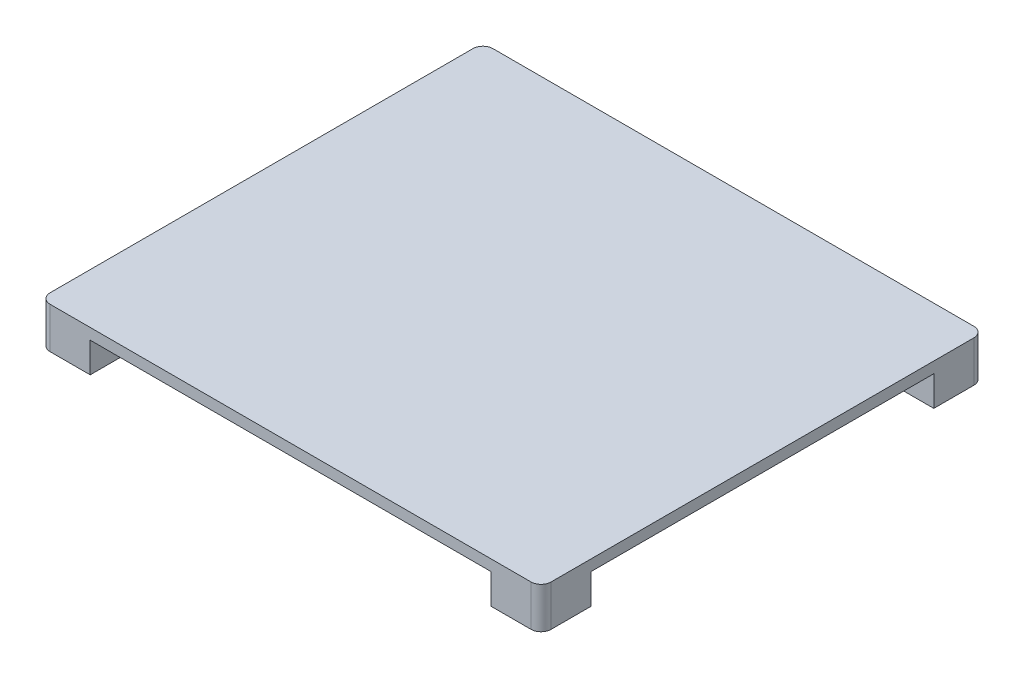
from build123d import *

# Parameters (mm, degrees)
CROQUIS1_W              = 250
CROQUIS1_H              = 221
SALIENTE_EXTRUIR1_DEPTH = 5.5
SALIENTE_EXTRUIR2_DEPTH = 15
CROQUIS3_W              = 150
CROQUIS3_H              = 100
SALIENTE_EXTRUIR3_DEPTH = 15
FILLET1_R               = 5


with BuildPart() as part:
    # Croquis1 → Saliente-Extruir1 (new body)
    with BuildSketch(Plane(origin=(0, 0, 0), x_dir=(1, 0, 0), z_dir=(0, 1, 0))):
        Rectangle(CROQUIS1_W, CROQUIS1_H)
    extrude(amount=SALIENTE_EXTRUIR1_DEPTH)

    # Croquis2 → Saliente-Extruir2 (add)
    with BuildSketch(Plane.XZ):
        Polygon((-125, 110.5), (-100, 110.5), (-100, 90.5), (-105, 90.5), (-105, 85.5), (-125, 85.5), align=None)
        Polygon((125, -110.5), (125, -85.5), (105, -85.5), (105, -90.5), (100, -90.5), (100, -110.5), align=None)
    saliente_extruir2 = extrude(amount=SALIENTE_EXTRUIR2_DEPTH)

    # Simetría1: Saliente-Extruir2 across plane
    add(saliente_extruir2.mirror(Plane.XY))

    # Croquis3 → Saliente-Extruir3 (add)
    with BuildSketch(Plane.XZ):
        Rectangle(CROQUIS3_W, CROQUIS3_H)
    extrude(amount=SALIENTE_EXTRUIR3_DEPTH)

    # Fillet1
    fillet1_edges = [part.edges().sort_by_distance(p)[0] for p in [
        (-125, -4.75, 110.5),
        (-125, -4.75, -110.5),
        (125, -4.75, -110.5),
        (125, -4.75, 110.5),
    ]]
    fillet(fillet1_edges, radius=FILLET1_R)


solid = part.part
